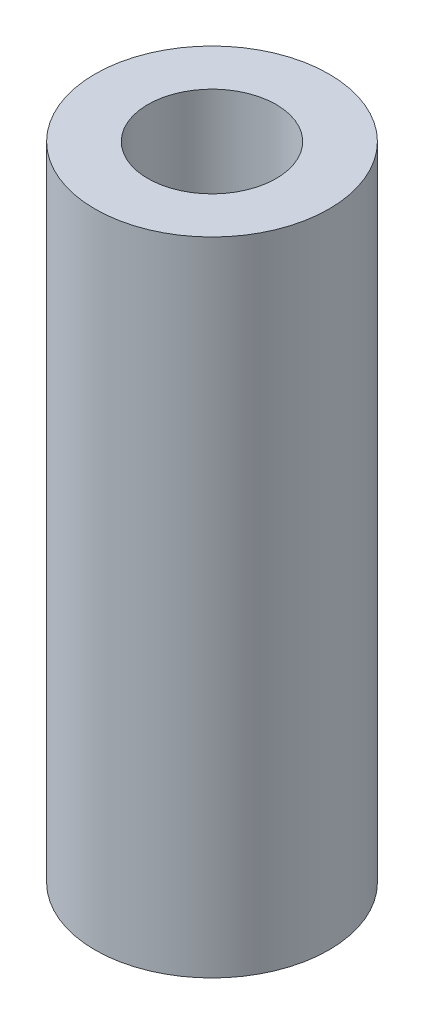
from build123d import *

# Parameters (mm, degrees)
SKETCH2_R           = 55.5625
SKETCH2_R_2         = 30.48
BOSS_EXTRUDE1_DEPTH = 304.8


with BuildPart() as part:
    # Sketch2 → Boss-Extrude1 (new body)
    with BuildSketch(Plane(origin=(0, 0, 0), x_dir=(1, 0, 0), z_dir=(0, 1, 0))):
        Circle(SKETCH2_R)
        Circle(SKETCH2_R_2, mode=Mode.SUBTRACT)
    extrude(amount=BOSS_EXTRUDE1_DEPTH)


solid = part.part
